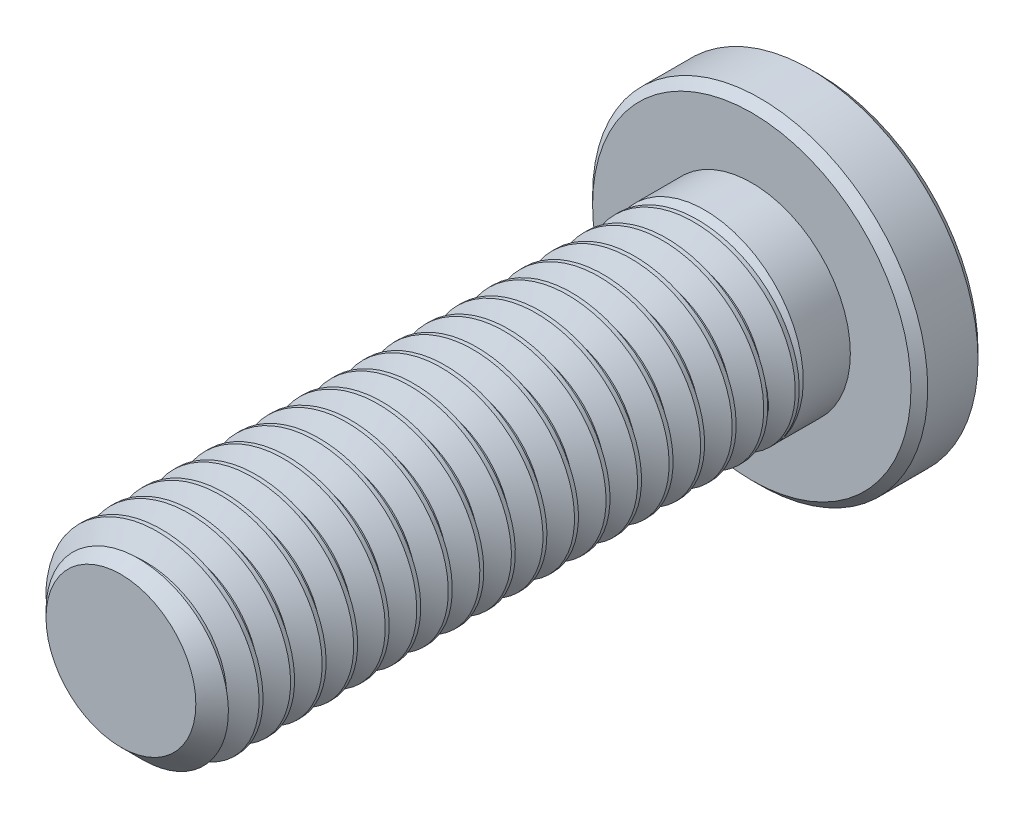
from build123d import *
from build123d.topology import SkipClean

# Parameters (mm, degrees)
EXTRUDE1_START     = -7.15
SKETCH1_R          = 2.5
EXTRUDE1_DEPTH     = 16
EXTRUDE2_START     = -8.85
SKETCH6_R          = 4.25
EXTRUDE2_DEPTH     = 1.7
CUT_EXTRUDE1_DEPTH = 1.275
SKETCH8_R          = 1.732050808
CUT_EXTRUDE2_DEPTH = 1.275
CUT_EXTRUDE2_TAPER = 45
CHAMFER1_SIZE      = 0.2125
CHAMFER2_SIZE      = 0.6
CUT_SWEEP1_PITCH   = 0.8
CUT_SWEEP1_TO      = 16


with BuildPart() as part:
    # Sketch1 → Extrude1 (new body)
    with BuildSketch(Plane.XY.offset(EXTRUDE1_START)):
        Circle(SKETCH1_R)
    extrude(amount=EXTRUDE1_DEPTH)

    # Sketch6 → Extrude2 (add)
    with BuildSketch(Plane.XY.offset(EXTRUDE2_START)):
        Circle(SKETCH6_R)
    extrude(amount=EXTRUDE2_DEPTH)

    # Sketch7 → Cut-Extrude1 (cut)
    with BuildSketch(Plane.XY.offset(-8.85)):
        Polygon((0, 1.732050808), (-1.5, 0.866025404), (-1.5, -0.866025404), (0, -1.732050808), (1.5, -0.866025404), (1.5, 0.866025404), align=None)
    extrude(amount=CUT_EXTRUDE1_DEPTH, mode=Mode.SUBTRACT)

    # Sketch8 → Cut-Extrude2 (cut)
    with BuildSketch(Plane.XY.offset(-8.85)):
        Circle(SKETCH8_R)
    extrude(amount=CUT_EXTRUDE2_DEPTH, taper=CUT_EXTRUDE2_TAPER, mode=Mode.SUBTRACT)

    # Chamfer1
    chamfer1_edges = [part.edges().sort_by_distance(p)[0] for p in [
        (-4.25, 0, -7.15),
        (-4.25, 0, -8.85),
    ]]
    chamfer(chamfer1_edges, length=CHAMFER1_SIZE)

    # Chamfer2
    chamfer2_edges = [part.edges().sort_by_distance(p)[0] for p in [
        (-2.5, 0, 8.85),
    ]]
    chamfer(chamfer2_edges, length=CHAMFER2_SIZE)


with BuildPart() as body_2:
    # Split1: read off the stored shape, not the designer's step
    # Split1: the piece on the far side of the plane
    add(part.part)
    split(bisect_by=Plane.XY.offset(-7.15), keep=Keep.BOTTOM)


with BuildPart() as part_1:
    add(part.part)

    # Split1
    split(bisect_by=Plane.XY.offset(-7.15), keep=Keep.TOP)

    # Cut-Sweep1: arcs per turn and ends read off the stored shape
    # Cut-Sweep1: the profile of Sketch3 screwed along a right-hand helix through 22 turns, 6 arcs to a turn; built about Z, then put on its axis
    cut_sweep1_z = Axis((0, 0, 0), (0, 0, 1))
    cut_sweep1_corners = [(1.980384758, 0, -0.4), (1.980384758, 0, -0.3), (2.54330127, 0, 0.025), (2.54330127, 0, -0.725)]
    with BuildLine(mode=Mode.PRIVATE) as cut_sweep1_profile:
        Line(cut_sweep1_corners[0], cut_sweep1_corners[1])
        Line(cut_sweep1_corners[1], cut_sweep1_corners[2])
        Line(cut_sweep1_corners[2], cut_sweep1_corners[3])
        Line(cut_sweep1_corners[3], cut_sweep1_corners[0])
    cut_sweep1_cap = Face(cut_sweep1_profile.wire())
    cut_sweep1_turn_angles = [0, 30, 60, 90, 120, 150, 180, 210, 240, 270, 300, 330, 360]
    cut_sweep1_turn_weights = [1, 0.8660254037844387, 1, 0.8660254037844387, 1, 0.8660254037844387, 1, 0.8660254037844387, 1, 0.8660254037844387, 1, 0.8660254037844387, 1]
    cut_sweep1_turn_rails = [Edge.make_bspline([Vector(p[0], p[1], 0).rotate(cut_sweep1_z, cut_sweep1_turn_angles[k]) / cut_sweep1_turn_weights[k] + Vector(0, 0, p[2] + CUT_SWEEP1_PITCH * cut_sweep1_turn_angles[k] / 360) for k in range(13)], [0, 0, 0, 1, 1, 2, 2, 3, 3, 4, 4, 5, 5, 6, 6, 6], 2, cut_sweep1_turn_weights) for p in cut_sweep1_corners]
    cut_sweep1_turn_sides = [Face.make_surface_from_curves(cut_sweep1_turn_rails[p[0]], cut_sweep1_turn_rails[p[1]]) for p in [(0, 1), (1, 2), (2, 3), (3, 0)]]
    cut_sweep1 = Plane(origin=(0, 0, 8.85), x_dir=(0, 1, 0), z_dir=(0, 0, -1)) * split(Solid(Shell([*[p.moved(Location((0, 0, CUT_SWEEP1_PITCH * i))) for i in range(22) for p in cut_sweep1_turn_sides], cut_sweep1_cap, cut_sweep1_cap.rotate(cut_sweep1_z, 7920).moved(Location((0, 0, CUT_SWEEP1_PITCH * 7920 / 360)))])), bisect_by=Plane.XY.offset(CUT_SWEEP1_TO), keep=Keep.BOTTOM, mode=Mode.PRIVATE)
    add(cut_sweep1, mode=Mode.SUBTRACT)

    with SkipClean():  # the faces are left unmerged after this step: merging them gives an invalid solid
        add(body_2.part)  # Revolve1 merges body 2
        # Sketch9 → Revolve1 (revolve)
        with BuildSketch(Plane(origin=(0, 0, 0), x_dir=(0, 0, -1), z_dir=(1, 0, 0)), mode=Mode.PRIVATE) as revolve1_sk:
            Polygon((7.15, 2.5), (5.9562, 2.5), (5.349982217, 1.893782217), (5.349982217, 0), (7.15, 0), align=None)
        revolve(revolve1_sk.sketch.rotate(Axis((0, 0, -8.85), (0, 0, 1)), 90), axis=Axis((0, 0, -8.85), (0, 0, 1)))


solid = part_1.part
